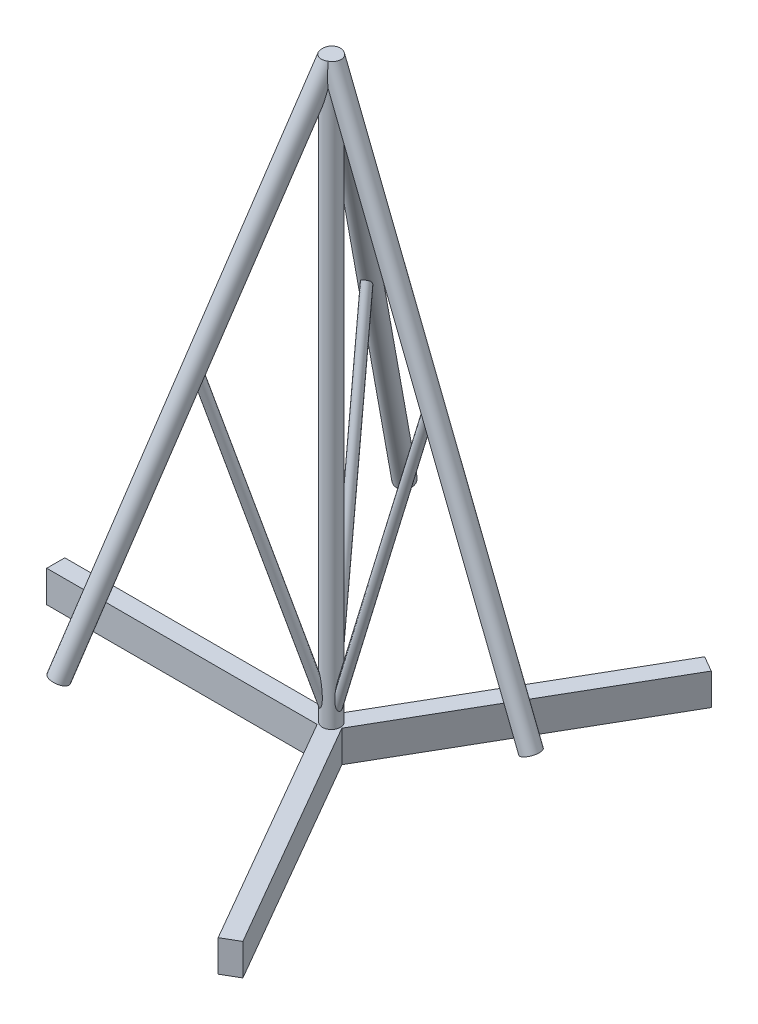
from build123d import *

# Parameters (mm, degrees)
SWEEP1_PROFILE_R    = 2
SWEEP2_PROFILE_R    = 1
CUT_EXTRUDE3_START  = -15
SKETCH50_R          = 5.464476383
CUT_EXTRUDE3_DEPTH  = 10.489956
CIRPATTERN2_COUNT   = 3
BOSS_EXTRUDE1_START = -7
BOSS_EXTRUDE1_DEPTH = 7


# Read off the part's stored shape, not the designer's step: Boss-Extrude1
with BuildPart() as part:
    # Sweep1: sweep along a curve in space
    with BuildLine() as sweep1_path:
        Line((0, 0, 0), (0, 135, 0))
        Line((0, 135, 0), (44.153062384, 23.418159712, 0))
    # Sweep1 profile (on start of the path) → Sweep1 (sweep)
    with BuildSketch(Plane(origin=(0, 0, 0), x_dir=(1, 0, 0), z_dir=(0, 1, 0))):
        Circle(SWEEP1_PROFILE_R)
    sweep1 = sweep(path=sweep1_path.line, transition=Transition.RIGHT)

    # Sweep2: sweep along a curve in space
    with BuildLine() as sweep2_path:
        Line((0, 7, 0), (22.076531192, 79.209079856, 0))
    # Sweep2 profile (on start of the path) → Sweep2 (sweep)
    with BuildSketch(Plane(origin=(0, 7, 0), x_dir=(0.9563047559630352, -0.2923717047227375, 0), z_dir=(0.2923717047227375, 0.9563047559630352, 0))):
        Circle(SWEEP2_PROFILE_R)
    sweep2 = sweep(path=sweep2_path.line)

    # Sketch50 → Cut-Extrude3 (cut)
    with BuildSketch(Plane(origin=(0, 150, 0), x_dir=(1, 0, 0), z_dir=(0, 1, 0)).offset(CUT_EXTRUDE3_START)):
        Circle(SKETCH50_R)
    cut_extrude3 = extrude(amount=CUT_EXTRUDE3_DEPTH, mode=Mode.SUBTRACT)

    # CirPattern2: Sweep1, Sweep2, Cut-Extrude3 ×3 about axis
    cirpattern2_axis = Axis((0, 0, 0), (0, 1, 0))
    add([sweep1.rotate(cirpattern2_axis, i * 360 / CIRPATTERN2_COUNT) for i in range(1, CIRPATTERN2_COUNT)])
    add([sweep2.rotate(cirpattern2_axis, i * 360 / CIRPATTERN2_COUNT) for i in range(1, CIRPATTERN2_COUNT)])
    add([cut_extrude3.rotate(cirpattern2_axis, i * 360 / CIRPATTERN2_COUNT) for i in range(1, CIRPATTERN2_COUNT)], mode=Mode.SUBTRACT)


with BuildPart() as body_2:
    # Boss-Extrude1 outline → Boss-Extrude1 (new body)
    with BuildSketch(Plane.XZ.offset(BOSS_EXTRUDE1_START)):
        Polygon((28.751551342, 53.79914772), (-1.154700538, 2), (-60.967204299, 2), (-60.967204299, -2), (-1.154700538, -2), (28.751551342, -53.79914772), (32.215652957, -51.79914772), (2.309401077, 0), (32.215652957, 51.79914772), align=None)
    extrude(amount=BOSS_EXTRUDE1_DEPTH)


solid = Compound([part.part, body_2.part])
